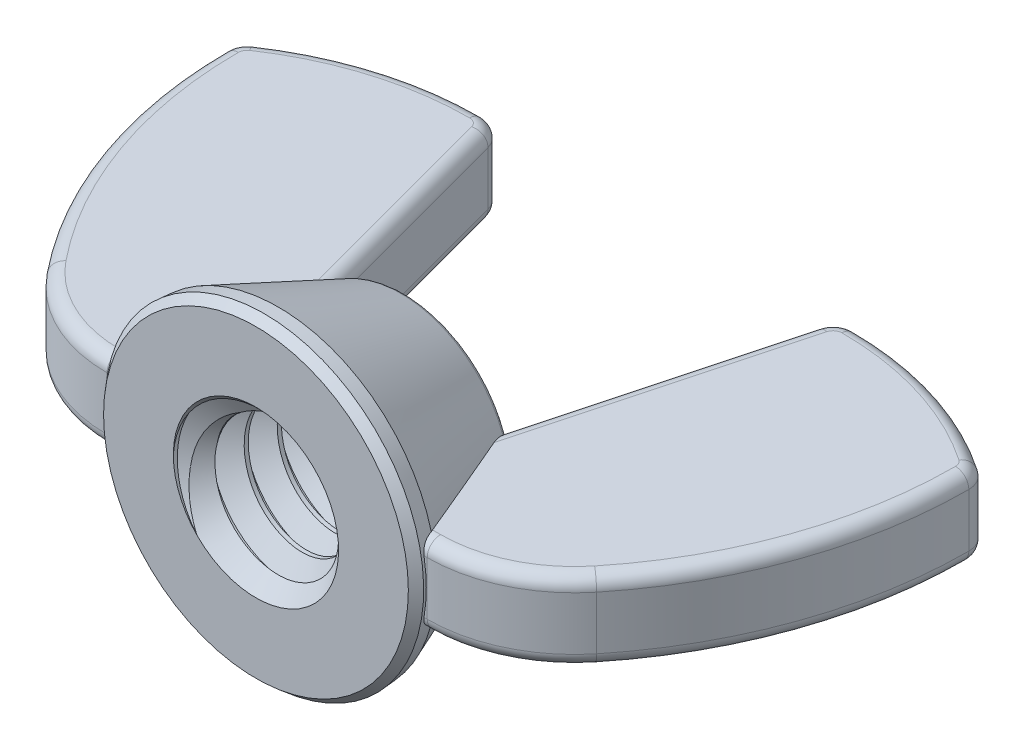
from build123d import *

# Parameters (mm, degrees)
EXTRUDE2_DEPTH     = 1.537890625
SKETCH3_R          = 6.1515625
EXTRUDE1_DEPTH     = 0.85725
EXTRUDE1_DRAFT     = -5
SKETCH15_R         = 6.076562843
EXTRUDE3_DEPTH     = 4.85775
EXTRUDE3_TAPER     = 21.960198558
FILLET3_R          = 0.254
SKETCH4_R          = 3.175
CUT_EXTRUDE1_DEPTH = 23.225885864
SWEEP1_PITCH       = 1.27
SKETCH7_R          = 6.1515625
CUT_EXTRUDE2_DEPTH = 23.225885892
SKETCH8_R          = 6.076562843
CUT_EXTRUDE3_DEPTH = 19.579558086
SKETCH11_R         = 3.1242
CUT_EXTRUDE5_DEPTH = 19.579558053
CUT_EXTRUDE5_TAPER = 45
CHAMFER1_SIZE      = 0.32146875
CHAMFER1_SIZE2     = 0.296735699
FILLET4_R          = 0.512630208


with BuildPart() as part:
    # Sketch13 → Extrude2 (new, symmetric)
    with BuildSketch(Plane(origin=(0, 0, 0), x_dir=(1, 0, 0), z_dir=(0, 1, 0))):
        with BuildLine():
            Line((3.773545526, 0.428625), (6.1515625, 0.428625))
            ThreePointArc((6.1515625, 0.428625), (8.590910612, 0.981496101), (10.553521716, 2.53205836))
            ThreePointArc((10.553521716, 2.53205836), (13.326559198, 7.495965423), (14.2875, 13.10013378))
            ThreePointArc((14.2875, 13.10013378), (14.187492334, 13.501242622), (13.91088161, 13.808449953))
            ThreePointArc((13.91088161, 13.808449953), (10.685615281, 15.346823078), (7.151500977, 15.875))
            ThreePointArc((7.151500977, 15.875), (6.631385147, 15.698444466), (6.326229714, 15.241747088))
            Line((6.326229714, 15.241747088), (3.773545526, 5.715))
            Line((3.773545526, 5.715), (3.773545526, 0.428625))
        make_face()
    extrude(amount=EXTRUDE2_DEPTH, both=True)

    # Fillet4
    fillet4_edges = [part.edges().sort_by_distance(p)[0] for p in [
        (8.590910612, 1.537890625, -0.981496101),
        (4.962554013, -1.537890625, -0.428625),
        (13.326559198, 1.537890625, -7.495965423),
        (14.187492334, 1.537890625, -13.501242622),
        (10.685615281, 1.537890625, -15.346823078),
        (6.631385147, 1.537890625, -15.698444466),
        (5.04988762, 1.537890625, -10.478373544),
        (4.962554013, 1.537890625, -0.428625),
        (5.04988762, -1.537890625, -10.478373544),
        (6.631385147, -1.537890625, -15.698444466),
        (10.685615281, -1.537890625, -15.346823078),
        (14.187492334, -1.537890625, -13.501242622),
        (13.326559198, -1.537890625, -7.495965423),
        (8.590910612, -1.537890625, -0.981496101),
    ]]
    fillet(fillet4_edges, radius=FILLET4_R)


with BuildPart() as body_2:
    # Sketch3 → Extrude1 (with draft: the straight prism first)
    with BuildSketch(Plane.XY):
        Circle(SKETCH3_R)
    extrude(amount=-EXTRUDE1_DEPTH)
    # Extrude1: the draft: its side faces are tilted about the plane it starts from
    extrude1_sides = [body_2.faces().sort_by_distance(p)[0] for p in [
        (-6.1515625, 0, -0.428625),
    ]]
    draft(extrude1_sides, Plane.XY, EXTRUDE1_DRAFT)

    # Sketch15 → Extrude3 (add)
    with BuildSketch(Plane(origin=(0, 0, -0.85725), x_dir=(-1, 0, 0), z_dir=(0, 0, -1))):
        Circle(SKETCH15_R)
    extrude(amount=EXTRUDE3_DEPTH, taper=EXTRUDE3_TAPER)

    # Fillet3
    fillet3_edges = [body_2.edges().sort_by_distance(p)[0] for p in [
        (4.117828705, 0, -5.715),
    ]]
    fillet(fillet3_edges, radius=FILLET3_R)

    # Sketch4 → Cut-Extrude1 (cut, through all)
    with BuildSketch(Plane.XY):
        Circle(SKETCH4_R)
    extrude(amount=-CUT_EXTRUDE1_DEPTH, mode=Mode.SUBTRACT)

    # Sweep1: the profile of Sketch6 profile screwed along a right-hand helix of 7 turns, 6 arcs to a turn; built about Z, then put on its axis
    sweep1_z = Axis((0, 0, 0), (0, 0, 1))
    sweep1_corners = [(3.1753, 0, -1.111423205), (2.350110803, 0, -0.635), (2.350110803, 0, -0.47625), (3.1753, 0, 0.000173205)]
    with BuildLine(mode=Mode.PRIVATE) as sweep1_profile:
        Line(sweep1_corners[0], sweep1_corners[1])
        Line(sweep1_corners[1], sweep1_corners[2])
        Line(sweep1_corners[2], sweep1_corners[3])
        Line(sweep1_corners[3], sweep1_corners[0])
    sweep1_cap = Face(sweep1_profile.wire())
    sweep1_turn_angles = [0, 30, 60, 90, 120, 150, 180, 210, 240, 270, 300, 330, 360]
    sweep1_turn_weights = [1, 0.8660254037844387, 1, 0.8660254037844387, 1, 0.8660254037844387, 1, 0.8660254037844387, 1, 0.8660254037844387, 1, 0.8660254037844387, 1]
    sweep1_turn_rails = [Edge.make_bspline([Vector(p[0], p[1], 0).rotate(sweep1_z, sweep1_turn_angles[k]) / sweep1_turn_weights[k] + Vector(0, 0, p[2] + SWEEP1_PITCH * sweep1_turn_angles[k] / 360) for k in range(13)], [0, 0, 0, 1, 1, 2, 2, 3, 3, 4, 4, 5, 5, 6, 6, 6], 2, sweep1_turn_weights) for p in sweep1_corners]
    sweep1_turn_sides = [Face.make_surface_from_curves(sweep1_turn_rails[p[0]], sweep1_turn_rails[p[1]]) for p in [(0, 1), (1, 2), (2, 3), (3, 0)]]
    sweep1 = Plane(origin=(0, 0, 0), x_dir=(-1, 0, 0), z_dir=(0, 0, -1)) * Solid(Shell([*[p.moved(Location((0, 0, SWEEP1_PITCH * i))) for i in range(7) for p in sweep1_turn_sides], sweep1_cap, sweep1_cap.rotate(sweep1_z, 2520).moved(Location((0, 0, SWEEP1_PITCH * 2520 / 360)))]))
    add(sweep1)

    # Sketch7 → Cut-Extrude2 (cut, through all)
    with BuildSketch(Plane.XY):
        Circle(SKETCH7_R)
    extrude(amount=CUT_EXTRUDE2_DEPTH, mode=Mode.SUBTRACT)

    # Sketch8 → Cut-Extrude3 (cut, through all)
    with BuildSketch(Plane.XY.offset(-5.715)):
        Circle(SKETCH8_R)
    extrude(amount=-CUT_EXTRUDE3_DEPTH, mode=Mode.SUBTRACT)

    # Cut-Extrude4 cone 1 section (through the dimple's axis) → Cut-Extrude4 (revolve, cut)
    with BuildSketch(Plane(origin=(0, 0, 0), x_dir=(0, -1, 0), z_dir=(1, 0, 0))):
        Polygon((0, 0), (3.175, 0), (0, 3.175), align=None)
    revolve(axis=Axis((0, 0, 0), (0, 0, -1)), mode=Mode.SUBTRACT)

    # Sketch11 → Cut-Extrude5 (cut, through all)
    with BuildSketch(Plane.XY.offset(-5.715)):
        Circle(SKETCH11_R)
    extrude(amount=CUT_EXTRUDE5_DEPTH, taper=CUT_EXTRUDE5_TAPER, mode=Mode.SUBTRACT)

    # Chamfer1
    chamfer1_edges = [body_2.edges().sort_by_distance(p)[0] for p in [
        (-6.1515625, 0, 0),
    ]]
    chamfer1_side = [body_2.faces().sort_by_distance(p)[0] for p in [
        (-6.114062672, 0, -0.428625),
    ]]
    chamfer(chamfer1_edges, length=CHAMFER1_SIZE, length2=CHAMFER1_SIZE2, reference=chamfer1_side[0])


with BuildPart() as body_3:
    # Mirror6: mirrored copy
    add(part.part.mirror(Plane(origin=(0, 0, 0), x_dir=(0, 0, 1), z_dir=(1, 0, 0))))

    # Combine2: union part, body 2
    add(part.part)
    add(body_2.part)


solid = body_3.part
